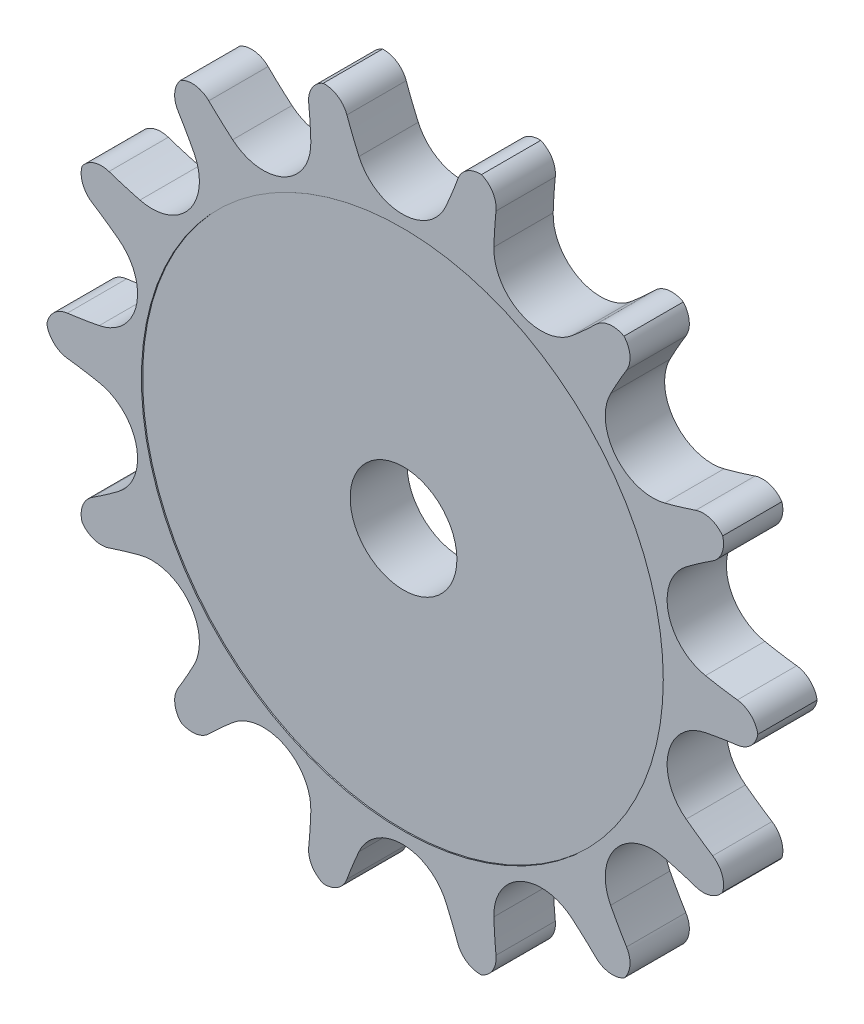
from build123d import *

# Parameters (mm, degrees)
SKETCH_1_R               = 30
EXTRUDE_1_DEPTH          = 5
SKETCH_2_R               = 4.5
CUT_EXTRUDE_1_DEPTH      = 43.720018727
CUT_EXTRUDE_7_DEPTH      = 43.720018727
PATTERN_CIRCULAR_1_COUNT = 14
FILLET_3_R               = 2
SKETCH_4_R               = 22
CUT_EXTRUDE_9_DEPTH      = 0.1
CUT_EXTRUDE_START        = -0.1
SKETCH_5_R               = 22
CUT_EXTRUDE_10_DEPTH     = 0.1


with BuildPart() as part:
    # 草图1 → 凸台-拉伸1 (new body)
    with BuildSketch(Plane.XY):
        Circle(SKETCH_1_R)
    extrude(amount=EXTRUDE_1_DEPTH)

    # 草图2 → 切除-拉伸1 (cut, through all)
    with BuildSketch(Plane.XY.offset(5)):
        Circle(SKETCH_2_R)
    extrude(amount=-CUT_EXTRUDE_1_DEPTH, mode=Mode.SUBTRACT)

    # 草图3 → 切除-拉伸7 (cut, through all)
    with BuildSketch(Plane.XY):
        with BuildLine():
            Line((0, 23), (0, 30))
            ThreePointArc((0, 30), (-2.625482426, 29.884893208), (-5.230817461, 29.540456135))
            ThreePointArc((-5.230817461, 29.540456135), (-4.501731259, 27.437843644), (-3.656838203, 25.379032895))
            ThreePointArc((-3.656838203, 25.379032895), (-2.181299106, 23.647100626), (0, 23))
        make_face()
        with BuildLine():
            ThreePointArc((5.230817461, 29.540456135), (2.625482426, 29.884893208), (0, 30))
            Line((0, 30), (0, 23))
            ThreePointArc((0, 23), (2.181299106, 23.647100626), (3.656838203, 25.379032895))
            ThreePointArc((3.656838203, 25.379032895), (4.501731259, 27.437843644), (5.230817461, 29.540456135))
        make_face()
    cut_extrude_7 = extrude(amount=CUT_EXTRUDE_7_DEPTH, mode=Mode.SUBTRACT)

    # 阵列(圆周)1: 切除-拉伸7 ×14 about axis
    pattern_circular_1_axis = Axis((0, 0, 0), (0, 0, 1))
    for i in range(1, PATTERN_CIRCULAR_1_COUNT):
        add(cut_extrude_7.rotate(pattern_circular_1_axis, i * 360 / PATTERN_CIRCULAR_1_COUNT), mode=Mode.SUBTRACT)

    # 圆角3
    # the kernel refuses this fillet: 2 mm, written as the material it takes off along each edge
    with BuildSketch(Plane(origin=(5.230817461, 29.540456135, -4.577149267), x_dir=(-0.32171090906550515, -0.9468379433610834, 0), z_dir=(0, 0, 1)), Plane(origin=(-19.834297271, 22.507790913, -4.577149267), x_dir=(0.5396842419659282, -0.8418675186593562, 0), z_dir=(0, 0, 1)), Plane(origin=(-27.635848838, 11.673039835, -4.577149267), x_dir=(0.8515113273463623, -0.5243362083633328, 0), z_dir=(0, 0, 1)), Plane(origin=(-29.963781612, -1.473699943, -4.577149267), x_dir=(0.9946861512447445, -0.10295368143936073, 0), z_dir=(0, 0, 1)), Plane(origin=(-26.357019955, -14.328555373, -4.577149267), x_dir=(0.9408511838640222, 0.33882008473770825, 0), z_dir=(0, 0, 1)), Plane(origin=(-17.529927249, -24.345464683, -4.577149267), x_dir=(0.7006691007364907, 0.7134863777768412, 0), z_dir=(0, 0, 1)), Plane(origin=(-5.230817461, -29.540456135, -4.577149267), x_dir=(0.32171090906550703, 0.9468379433610828, 0), z_dir=(0, 0, 1)), Plane(origin=(8.104319877, -28.88459796, -4.577149267), x_dir=(-0.12096607367127866, 0.9926566420573404, 0), z_dir=(0, 0, 1)), Plane(origin=(19.834297271, -22.507790913, -4.577149267), x_dir=(-0.5396842419659312, 0.8418675186593543, 0), z_dir=(0, 0, 1)), Plane(origin=(27.635848838, -11.673039835, -4.577149267), x_dir=(-0.8515113273463634, 0.524336208363331, 0), z_dir=(0, 0, 1)), Plane(origin=(29.963781612, 1.473699943, -4.577149267), x_dir=(-0.9946861512447445, 0.10295368143936018, 0), z_dir=(0, 0, 1)), Plane(origin=(26.357019955, 14.328555373, -4.577149267), x_dir=(-0.9408511838640224, -0.3388200847377076, 0), z_dir=(0, 0, 1)), Plane(origin=(17.529927249, 24.345464683, -4.577149267), x_dir=(-0.7006691007364938, -0.7134863777768381, 0), z_dir=(0, 0, 1))) as fillet_3_piece_1:
        with BuildLine():
            CenterArc((1.769304863, 1.999534384), FILLET_3_R, 185.227747584, 83.53589182)
            ThreePointArc((-0.222375917, 1.817304657), (-0.125054645, 0.906955521), (0, 0))
            ThreePointArc((0, 0), (0.863075543, 0.009312326), (1.726151086, 0))
        make_face()
    extrude(amount=14.154298534, mode=Mode.SUBTRACT)
    with BuildSketch(Plane(origin=(-5.230817461, 29.540456135, -4.577149267), x_dir=(-0.9789028377703077, -0.20432629347501635, 0), z_dir=(0, 0, 1)), Plane(origin=(-17.529927249, 24.345464683, -4.577149267), x_dir=(-0.7933071253194062, -0.6088216527994549, 0), z_dir=(0, 0, 1)), Plane(origin=(-26.357019955, 14.328555373, -4.577149267), x_dir=(-0.4505872074255905, -0.8927324170793888, 0), z_dir=(0, 0, 1)), Plane(origin=(-29.963781612, 1.473699943, -4.577149267), x_dir=(-0.018622967011686854, -0.9998265775121612, 0), z_dir=(0, 0, 1)), Plane(origin=(-27.635848838, -11.673039835, -4.577149267), x_dir=(0.4170297804145827, -0.9088928222003764, 0), z_dir=(0, 0, 1)), Plane(origin=(-19.834297271, -22.507790913, -4.577149267), x_dir=(0.7700846652951304, -0.6379416966128542, 0), z_dir=(0, 0, 1)), Plane(origin=(-8.104319877, -28.88459796, -4.577149267), x_dir=(0.9706148377453508, -0.24063839416968846, 0), z_dir=(0, 0, 1)), Plane(origin=(5.230817461, -29.540456135, -4.577149267), x_dir=(0.9789028377703077, 0.20432629347501674, 0), z_dir=(0, 0, 1)), Plane(origin=(17.529927249, -24.345464683, -4.577149267), x_dir=(0.7933071253194082, 0.6088216527994523, 0), z_dir=(0, 0, 1)), Plane(origin=(26.357019955, -14.328555373, -4.577149267), x_dir=(0.45058720742559166, 0.8927324170793882, 0), z_dir=(0, 0, 1)), Plane(origin=(29.963781612, -1.473699943, -4.577149267), x_dir=(0.01862296701168685, 0.9998265775121612, 0), z_dir=(0, 0, 1)), Plane(origin=(27.635848838, 11.673039835, -4.577149267), x_dir=(-0.4170297804145869, 0.9088928222003745, 0), z_dir=(0, 0, 1)), Plane(origin=(19.834297271, 22.507790913, -4.577149267), x_dir=(-0.7700846652951312, 0.6379416966128533, 0), z_dir=(0, 0, 1)), Plane(origin=(8.104319877, 28.88459796, -4.577149267), x_dir=(-0.9706148377453518, 0.24063839416968458, 0), z_dir=(0, 0, 1))) as fillet_3_piece_2:
        with BuildLine():
            CenterArc((1.76983105, 1.999068659), FILLET_3_R, 188.212721849, 83.53589182)
            ThreePointArc((-0.209658025, 1.713371262), (-0.095585631, 0.857816705), (0, 0))
            ThreePointArc((0, 0), (0.915429853, -0.013970116), (1.830859707, 0))
        make_face()
    extrude(amount=14.154298534, mode=Mode.SUBTRACT)
    with BuildSketch(Plane(origin=(-8.104319877, 28.88459796, -4.577149267), x_dir=(0.9706148377453514, 0.24063839416968652, 0), z_dir=(0, 0, 1))) as fillet_3_piece_3:
        with BuildLine():
            CenterArc((1.76983105, -1.999068659), FILLET_3_R, 88.251386331, 83.53589182)
            ThreePointArc((-0.209658025, -1.713371262), (-0.095585631, -0.857816705), (0, 0))
            ThreePointArc((0, 0), (0.915429853, 0.013970116), (1.830859707, 0))
        make_face()
    extrude(amount=14.154298534, mode=Mode.SUBTRACT)

    # 草图4 → 切除-拉伸9 (cut)
    with BuildSketch(Plane.XY.offset(5)):
        Circle(SKETCH_4_R)
    extrude(amount=-CUT_EXTRUDE_9_DEPTH, mode=Mode.SUBTRACT)

    # 草图5 → 切除-拉伸10 (cut)
    with BuildSketch(Plane(origin=(0, 0, 0), x_dir=(-1, 0, 0), z_dir=(0, 0, -1)).offset(CUT_EXTRUDE_START)):
        with Locations(Location((0, 0, 0), (0, 0, 180))):
            Circle(SKETCH_5_R)
    extrude(amount=CUT_EXTRUDE_10_DEPTH, mode=Mode.SUBTRACT)


solid = part.part
